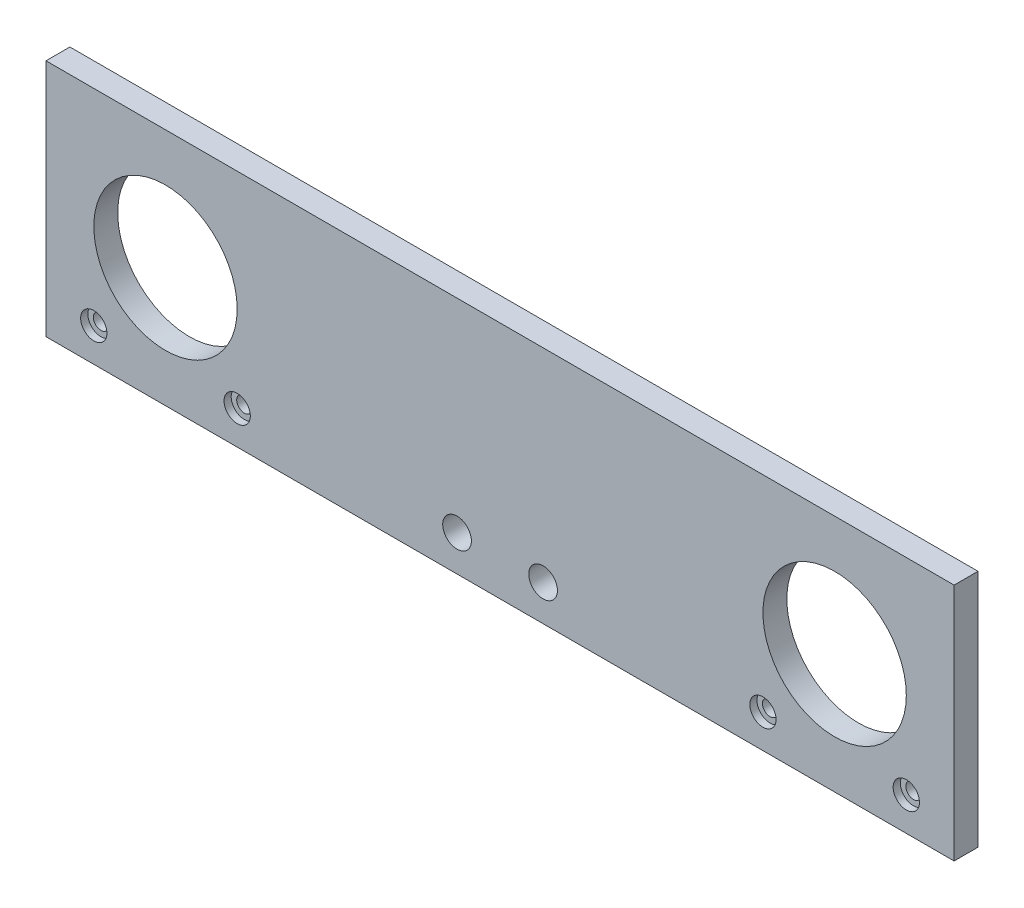
from build123d import *

# Parameters (mm, degrees)
SKETCH1_W           = 190
SKETCH1_H           = 50
SKETCH1_R           = 1.6
SKETCH1_R_2         = 3
SKETCH1_R_3         = 15
BOSS_EXTRUDE1_DEPTH = 5
SKETCH3_R           = 2.75
CUT_EXTRUDE1_DEPTH  = 1.5


with BuildPart() as part:
    # Sketch1 → Boss-Extrude1 (new body)
    with BuildSketch(Plane.XY):
        with Locations((95, 25)):
            Rectangle(SKETCH1_W, SKETCH1_H)
        with Locations((10, 7)):
            Circle(SKETCH1_R, mode=Mode.SUBTRACT)
        with Locations((40, 7)):
            Circle(SKETCH1_R, mode=Mode.SUBTRACT)
        with Locations((86, 7.5)):
            Circle(SKETCH1_R_2, mode=Mode.SUBTRACT)
        with Locations((25, 25)):
            Circle(SKETCH1_R_3, mode=Mode.SUBTRACT)
        with Locations((104, 7.5)):
            Circle(SKETCH1_R_2, mode=Mode.SUBTRACT)
        with Locations((150, 7)):
            Circle(SKETCH1_R, mode=Mode.SUBTRACT)
        with Locations((180, 7)):
            Circle(SKETCH1_R, mode=Mode.SUBTRACT)
        with Locations((165, 25)):
            Circle(SKETCH1_R_3, mode=Mode.SUBTRACT)
    extrude(amount=BOSS_EXTRUDE1_DEPTH)

    # Sketch3 → Cut-Extrude1 (cut)
    with BuildSketch(Plane.XY.offset(5)):
        with Locations((10, 7)):
            Circle(SKETCH3_R)
        with Locations((40, 7)):
            Circle(SKETCH3_R)
        with Locations((150, 7)):
            Circle(SKETCH3_R)
        with Locations((180, 7)):
            Circle(SKETCH3_R)
    extrude(amount=-CUT_EXTRUDE1_DEPTH, mode=Mode.SUBTRACT)


solid = part.part
